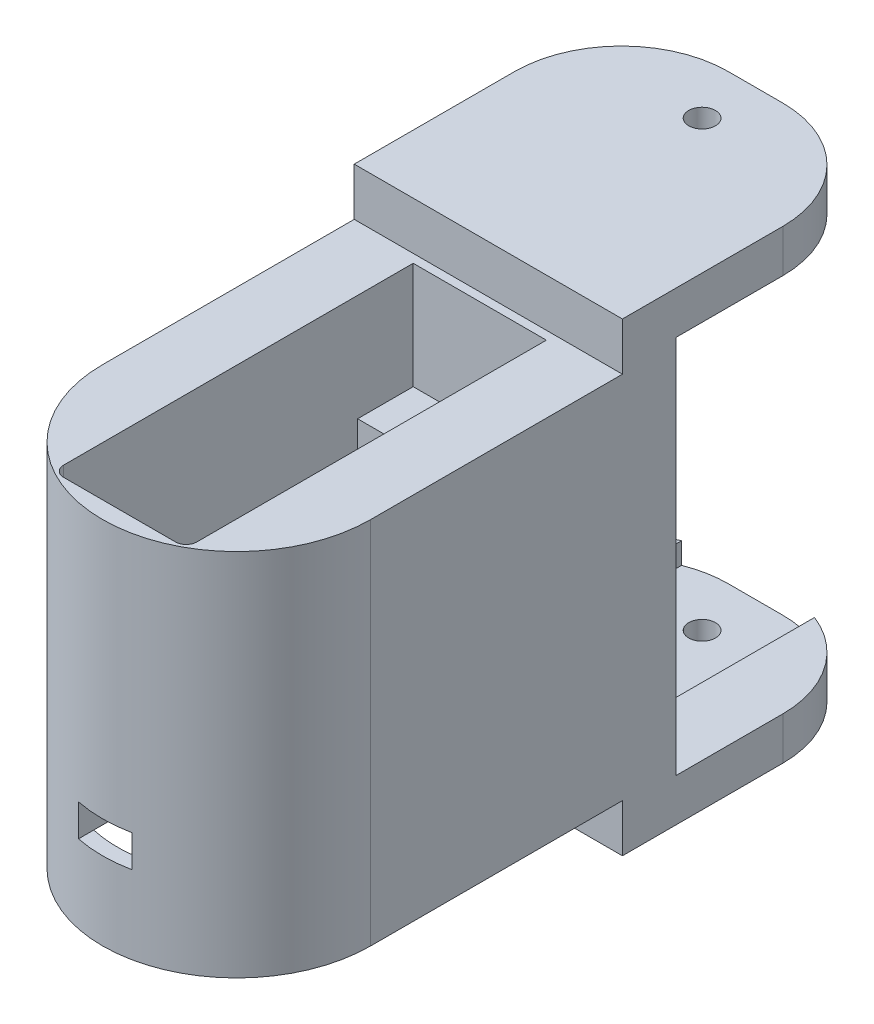
from build123d import *
from OCP.BRepFilletAPI import BRepFilletAPI_MakeChamfer

# Parameters (mm, degrees)
SKETCH4_W                = 12.46
SKETCH4_H                = 17.25
BOSS_EXTRUDE3_DEPTH      = 6
BOSS_EXTRUDE6_DEPTH      = 7.3
BOSS_EXTRUDE6_DEPTH_BACK = 17.25
SKETCH8_R                = 12.546781182
SKETCH8_R_2              = 11.15
BOSS_EXTRUDE4_DEPTH      = 17.25
SKETCH6_R                = 2
CUT_EXTRUDE1_DEPTH       = 5
CHAMFER1_SIZE            = 0.5
CHAMFER1_SIZE_2          = 0.866025404
SKETCH10_W               = 12.46
SKETCH10_H               = 23.7
CUT_EXTRUDE3_DEPTH       = 17.25
CUT_EXTRUDE4_REACH       = 43.938
SKETCH11_W               = 5
SKETCH11_H               = 3
BOSS_EXTRUDE7_START      = -7.3
BOSS_EXTRUDE7_DEPTH      = 7.3
BOSS_EXTRUDE9_START      = 10
BOSS_EXTRUDE9_DEPTH      = 10
BOSS_EXTRUDE10_DEPTH     = 25.093562364
SKETCH18_W               = 20
SKETCH18_H               = 12.438292938
CUT_EXTRUDE5_DEPTH       = 2
CUT_EXTRUDE6_DEPTH       = 57.41497434
CUT_EXTRUDE6_DEPTH_BACK  = 57.41497434
SKETCH19_R               = 1.25
FILLET1_R                = 10


with BuildPart() as part:
    # Sketch4 → Boss-Extrude3 (new body)
    with BuildSketch(Plane.XY):
        with Locations((0, -1.35)):
            Rectangle(SKETCH4_W, SKETCH4_H)
    extrude(amount=BOSS_EXTRUDE3_DEPTH)



with BuildPart() as body_2:
    # Sketch8 → Boss-Extrude6 (new, two sides: drawn at the far end of the back side and taken through both)
    with BuildSketch(Plane(origin=(0, -9.975, 0), x_dir=(-1, 0, 0), z_dir=(0, -1, 0)).offset(-BOSS_EXTRUDE6_DEPTH_BACK)):
        with Locations(Location((0, -23.55, 0), (0, 0, 90))):
            Circle(SKETCH8_R)
        with Locations(Location((0, -23.55, 0), (0, 0, 90))):
            Circle(SKETCH8_R_2, mode=Mode.SUBTRACT)
    extrude(amount=BOSS_EXTRUDE6_DEPTH + BOSS_EXTRUDE6_DEPTH_BACK)


with BuildPart() as part_1:
    add(part.part)

    add(body_2.part)  # Boss-Extrude4 merges body 2
    # Sketch5 → Boss-Extrude4 (add)
    with BuildSketch(Plane(origin=(0, 7.275, 0), x_dir=(1, 0, 0), z_dir=(0, 1, 0))):
        with BuildLine():
            Line((12.546781182, -23.55), (12.546781182, 0))
            Line((12.546781182, 0), (6.23, 0))
            Line((6.23, 0), (6.23, -29.7))
            Line((6.23, -29.7), (-6.23, -29.7))
            Line((-6.23, -29.7), (-6.23, 0))
            Line((-6.23, 0), (-12.546781182, 0))
            Line((-12.546781182, 0), (-12.546781182, -23.55))
            ThreePointArc((-12.546781182, -23.55), (0, -36.096781182), (12.546781182, -23.55))
        make_face()
    extrude(amount=-BOSS_EXTRUDE4_DEPTH)

    # Sketch6 → Cut-Extrude1 (cut)
    with BuildSketch(Plane(origin=(0, 7.275, 0), x_dir=(1, 0, 0), z_dir=(0, 1, 0))):
        with Locations(Location((0, -3.5, 0), (0, 0, 270))):
            Circle(SKETCH6_R)
        with Locations(Location((0, -32.2, 0), (0, 0, 270))):
            Circle(SKETCH6_R)
    extrude(amount=-CUT_EXTRUDE1_DEPTH, mode=Mode.SUBTRACT)

    # Chamfer1
    chamfer1_edges_1 = [part_1.edges().sort_by_distance(p)[0] for p in [
        (0, 7.275, 1.5),
    ]]
    chamfer1_side_1 = [part_1.faces().sort_by_distance(p)[0] for p in [
        (0, 7.275, 1.49),
    ]]
    chamfer1_edges_2 = [part_1.edges().sort_by_distance(p)[0] for p in [
        (0, 7.275, 30.2),
    ]]
    chamfer1_side_2 = [part_1.faces().sort_by_distance(p)[0] for p in [
        (0, 7.275, 30.19),
    ]]
    chamfer1 = BRepFilletAPI_MakeChamfer(part_1.part.solid().wrapped)
    for e in chamfer1_edges_1:
        chamfer1.Add(CHAMFER1_SIZE - 0.0001, CHAMFER1_SIZE_2 - 0.0001, e.wrapped, chamfer1_side_1[0].wrapped)
    for e in chamfer1_edges_2:
        chamfer1.Add(CHAMFER1_SIZE - 0.0001, CHAMFER1_SIZE_2 - 0.0001, e.wrapped, chamfer1_side_2[0].wrapped)
    add(Compound.cast(chamfer1.Shape()), mode=Mode.REPLACE)  # a hair under: the kernel refuses the full size

    # Sketch10 → Cut-Extrude3 (cut)
    with BuildSketch(Plane(origin=(0, 7.275, 0), x_dir=(1, 0, 0), z_dir=(0, 1, 0))):
        with Locations((0, -17.85)):
            Rectangle(SKETCH10_W, SKETCH10_H)
    extrude(amount=-CUT_EXTRUDE3_DEPTH, mode=Mode.SUBTRACT)

    # Sketch11 → Cut-Extrude4 (cut, up to next)
    with BuildSketch(Plane.XY.offset(36.096781182), mode=Mode.PRIVATE) as cut_extrude4_sk1:
        with Locations((0, -8.475)):
            Rectangle(SKETCH11_W, SKETCH11_H)
    cut_extrude4_tool1 = extrude(cut_extrude4_sk1.sketch, amount=-CUT_EXTRUDE4_REACH, mode=Mode.PRIVATE) & part_1.part
    add(cut_extrude4_tool1.solids().sort_by_distance((0, -8.475, 36.096781))[0], mode=Mode.SUBTRACT)

    # Sketch13 → Boss-Extrude7 (add)
    with BuildSketch(Plane.XZ.offset(17.275).offset(BOSS_EXTRUDE7_START)):
        with BuildLine():
            Line((-12.546781182, 23.55), (-12.546781182, 0))
            Line((-12.546781182, 0), (12.546781182, 0))
            Line((12.546781182, 0), (12.546781182, 23.55))
            ThreePointArc((12.546781182, 23.55), (0, 11.003218818), (-12.546781182, 23.55))
        make_face()
    extrude(amount=BOSS_EXTRUDE7_DEPTH)

    # Sketch15 → Boss-Extrude9 (add)
    with BuildSketch(Plane(origin=(0, 7.275, 0), x_dir=(1, 0, 0), z_dir=(0, 1, 0)).offset(BOSS_EXTRUDE9_START)):
        with BuildLine():
            Line((-12.546781182, 0), (12.546781182, 0))
            Line((12.546781182, 0), (12.546781182, -23.55))
            ThreePointArc((12.546781182, -23.55), (0, -36.096781182), (-12.546781182, -23.55))
            Line((-12.546781182, -23.55), (-12.546781182, 0))
        make_face()
        with BuildLine():
            Line((-6.23, -0.8), (6.23, -0.8))
            Line((6.23, -0.8), (6.23, -33.5))
            ThreePointArc((6.23, -33.5), (5.937106781, -34.207106781), (5.23, -34.5))
            Line((5.23, -34.5), (-5.23, -34.5))
            ThreePointArc((-5.23, -34.5), (-5.937106781, -34.207106781), (-6.23, -33.5))
            Line((-6.23, -33.5), (-6.23, -0.8))
        make_face(mode=Mode.SUBTRACT)
    extrude(amount=-BOSS_EXTRUDE9_DEPTH)

    # Sketch17 → Boss-Extrude10 (add)
    with BuildSketch(Plane(origin=(-12.546781182, 4.728218818, 0), x_dir=(0, -1, 0), z_dir=(1, 0, 0))):
        Polygon((26.478218818, 25), (26.478218818, 0), (-17.021781182, 0), (-17.021781182, 25), (-13.021781182, 25), (-13.021781182, 5), (22.478218818, 5), (22.478218818, 25), align=None)
    extrude(amount=BOSS_EXTRUDE10_DEPTH)

    # Sketch18 → Cut-Extrude5 (cut)
    with BuildSketch(Plane.ZX.offset(-17.75)):
        with Locations((-15, 0)):
            Rectangle(SKETCH18_W, SKETCH18_H)
    extrude(amount=-CUT_EXTRUDE5_DEPTH, mode=Mode.SUBTRACT)

    # Sketch19 → Cut-Extrude6 (cut, two sides: drawn at the far end of the back side and taken through both)
    with BuildSketch(Plane.ZX.offset(-19.75).offset(-CUT_EXTRUDE6_DEPTH_BACK)):
        with Locations((-20, 0)):
            Circle(SKETCH19_R)
    extrude(amount=CUT_EXTRUDE6_DEPTH + CUT_EXTRUDE6_DEPTH_BACK, mode=Mode.SUBTRACT)

    # Fillet1
    fillet1_edges = [part_1.edges().sort_by_distance(p)[0] for p in [
        (12.546781182, -19.75, -25),
        (-12.546781182, -19.75, -25),
        (12.546781182, 19.75, -25),
        (-12.546781182, 19.75, -25),
    ]]
    fillet(fillet1_edges, radius=FILLET1_R)


solid = part_1.part
